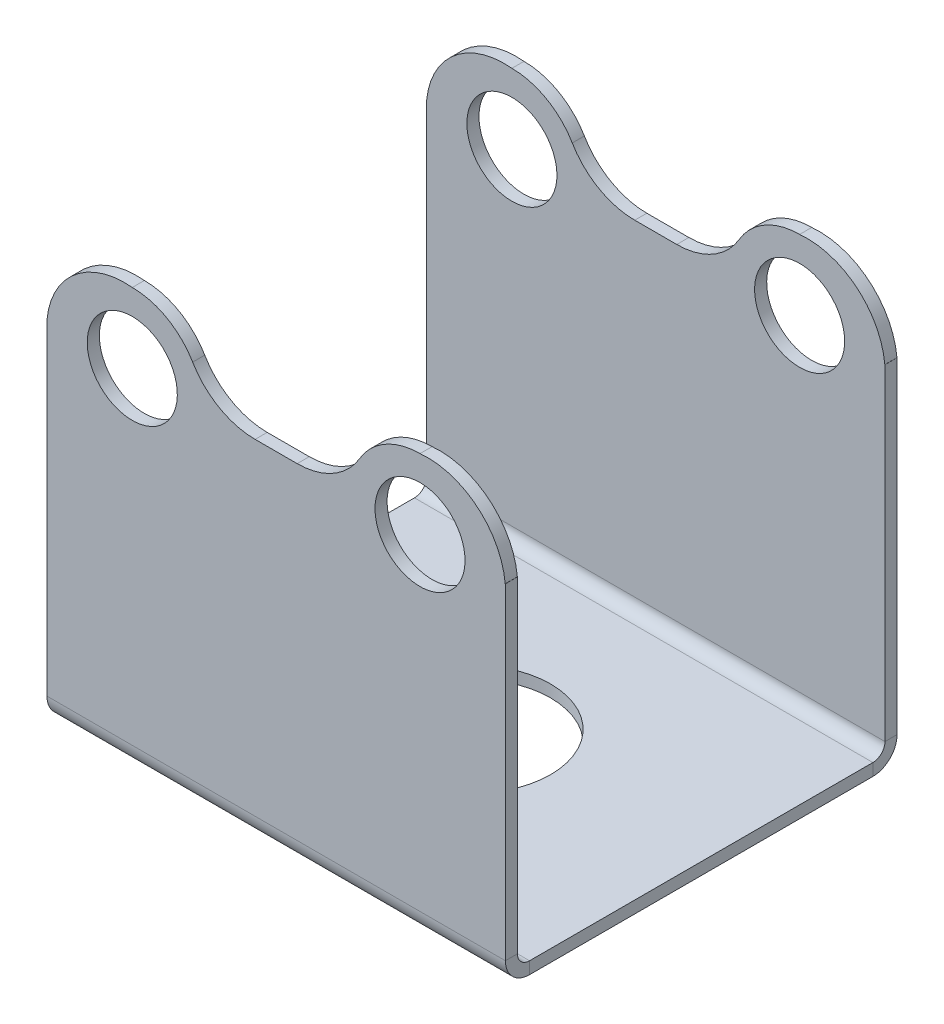
from build123d import *

# Parameters (mm, degrees)
SKETCH1_W               = 48.1584
SKETCH1_H               = 36.068
SKETCH1_R               = 8.255
BASE_FLANGE1_DEPTH      = 1.27
EDGE_FLANGE1_DEPTH      = 48.1584
EDGE_FLANGE1_START      = 1.27
EDGE_FLANGE1_PROFILE_W  = 48.1584
EDGE_FLANGE1_PROFILE_H  = 43.2562
EDGE_FLANGE1_PROFILE_R  = 4.73075
EDGE_FLANGE1_FLAT_DEPTH = 1.27
CUT_EXTRUDE7_DEPTH      = 66.234563408
FILLET2_R               = 7.62


# Sheet-metal steps are written as plain solids
with BuildPart() as part:
    # Sketch1 → Base-Flange1 (new body)
    with BuildSketch(Plane(origin=(0, 0, 0), x_dir=(1, 0, 0), z_dir=(0, 1, 0))):
        Rectangle(SKETCH1_W, SKETCH1_H)
        with Locations(Location((0, 0, 0), (0, 0, 270))):
            Circle(SKETCH1_R, mode=Mode.SUBTRACT)
    extrude(amount=-BASE_FLANGE1_DEPTH)

    # Edge-Flange1 bend section (across the edge) → Edge-Flange1 (add)
    with BuildSketch(Plane(origin=(24.0792, 0, -19.304), x_dir=(0, 0, 1), z_dir=(-1, 0, 0))):
        with BuildLine():
            Line((-1.27, 1.27), (0, 1.27))
            ThreePointArc((0, 1.27), (0.371974388, 0.371974388), (1.27, 0))
            Line((1.27, 0), (1.27, -1.27))
            ThreePointArc((1.27, -1.27), (-0.526051224, -0.526051224), (-1.27, 1.27))
        make_face()
    edge_flange1 = extrude(amount=EDGE_FLANGE1_DEPTH)

    # Edge-Flange1 profile (on flange) → Edge-Flange1 flat (add)
    with BuildSketch(Plane(origin=(0, 0, -19.304), x_dir=(-1, 0, 0), z_dir=(0, 0, -1)).offset(EDGE_FLANGE1_START)):
        with Locations((0, 22.8981)):
            Rectangle(EDGE_FLANGE1_PROFILE_W, EDGE_FLANGE1_PROFILE_H)
        with Locations((15.113, 35.56)):
            Circle(EDGE_FLANGE1_PROFILE_R, mode=Mode.SUBTRACT)
        with Locations((-15.113, 35.56)):
            Circle(EDGE_FLANGE1_PROFILE_R, mode=Mode.SUBTRACT)
    edge_flange1_flat = extrude(amount=-EDGE_FLANGE1_FLAT_DEPTH)

    # Mirror1: Edge-Flange1, Edge-Flange1 flat across plane
    add(edge_flange1.mirror(Plane.XY))
    add(edge_flange1_flat.mirror(Plane.XY))

    # Sketch11 → Cut-Extrude7 (cut, through all)
    with BuildSketch(Plane(origin=(0, 0, -20.574), x_dir=(-1, 0, 0), z_dir=(0, 0, -1))):
        with BuildLine():
            Line((24.0792, 35.56), (24.0792, 44.5262))
            Line((24.0792, 44.5262), (-24.0792, 44.5262))
            Line((-24.0792, 44.5262), (-24.0792, 35.56))
            Line((-24.0792, 35.56), (-24.066339002, 35.56))
            ThreePointArc((-24.066339002, 35.56), (-21.115218051, 41.097297222), (-15.113, 42.926))
            ThreePointArc((-15.113, 42.926), (-9.90445145, 40.76854855), (-7.747, 35.56))
            Line((-7.747, 35.56), (7.747, 35.56))
            ThreePointArc((7.747, 35.56), (9.90445145, 40.76854855), (15.113, 42.926))
            ThreePointArc((15.113, 42.926), (21.115218051, 41.097297222), (24.066339002, 35.56))
            Line((24.066339002, 35.56), (24.0792, 35.56))
        make_face()
    extrude(amount=-CUT_EXTRUDE7_DEPTH, mode=Mode.SUBTRACT)

    # Fillet2
    fillet2_edges = [part.edges().sort_by_distance(p)[0] for p in [
        (-7.747, 35.56, -19.939),
        (7.747, 35.56, -19.939),
        (-7.747, 35.56, 19.939),
        (7.747, 35.56, 19.939),
    ]]
    fillet(fillet2_edges, radius=FILLET2_R)


solid = part.part
